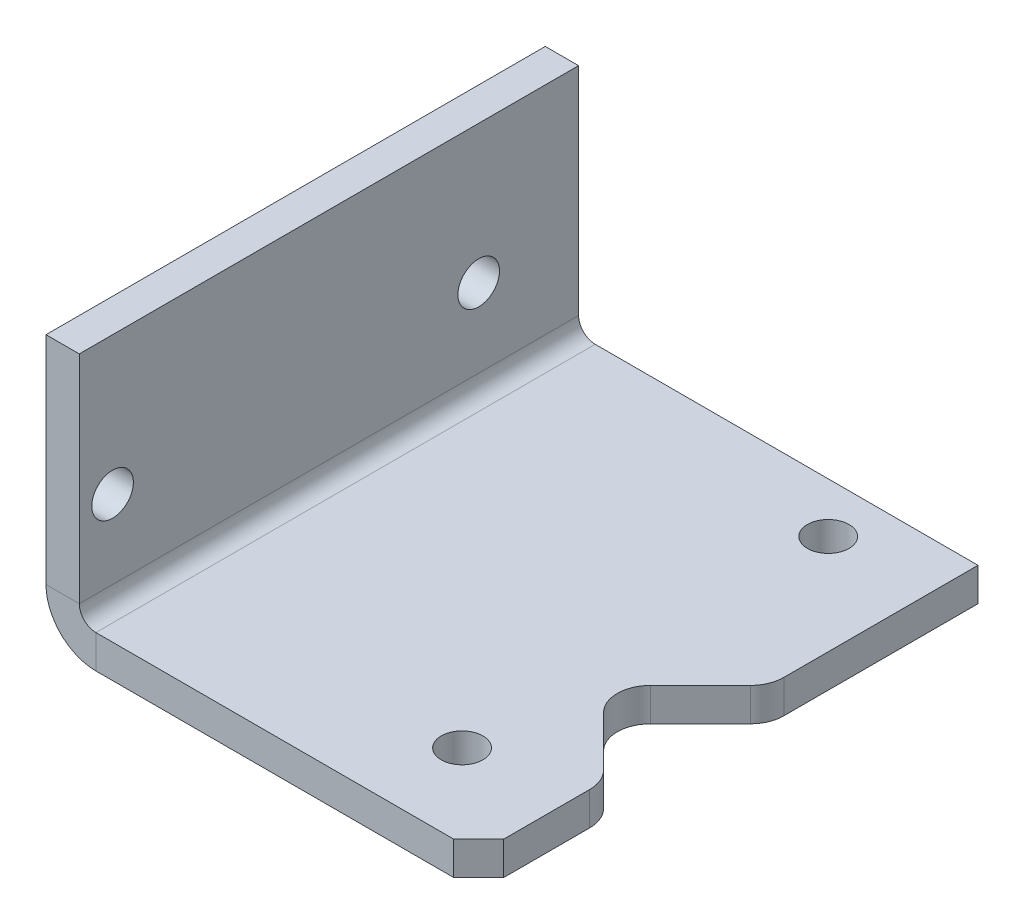
from build123d import *

# Parameters (mm, degrees)
ESBO_O1_W                      = 30
ESBO_O1_H                      = 14
FLANGE_BASE1_DEPTH             = 2
ARESTA_FLANGE1_STRIP_W         = 10
ARESTA_FLANGE1_STRIP_H         = 2
ARESTA_FLANGE1_STRIP_CUT_DEPTH = 30
ARESTA_FLANGE1_DEPTH           = 30
ESBO_O10_R                     = 1.25
CORTE_EXTRUS_O1_DEPTH          = 2
ESBO_O11_R                     = 1.25
CORTE_EXTRUS_O2_DEPTH          = 2
CHANFRO1_SIZE                  = 1.5
CORTE_EXTRUS_O3_DEPTH          = 2
FILETE1_R                      = 2


# Sheet-metal steps are written as plain solids
with BuildPart() as part:
    # Esboço1 → Flange-base1 (new body)
    with BuildSketch(Plane(origin=(0, 0, 0), x_dir=(0, 0, -1), z_dir=(1, 0, 0))):
        Rectangle(ESBO_O1_W, ESBO_O1_H)
    extrude(amount=-FLANGE_BASE1_DEPTH)

    # Aresta-Flange1 strip (across the edge) → Aresta-Flange1 strip cut (cut)
    with BuildSketch(Plane(origin=(0, -7, 15), x_dir=(0, 1, 0), z_dir=(0, 0, -1))):
        with Locations((-4, -1)):
            Rectangle(ARESTA_FLANGE1_STRIP_W, ARESTA_FLANGE1_STRIP_H)
    extrude(amount=ARESTA_FLANGE1_STRIP_CUT_DEPTH, mode=Mode.SUBTRACT)

    # Aresta-Flange1 section (across the edge) → Aresta-Flange1 (add)
    with BuildSketch(Plane(origin=(0, -7, 15), x_dir=(0, 1, 0), z_dir=(0, 0, -1))):
        with BuildLine():
            Line((-2, 1), (-2, 24))
            Line((-2, 24), (0, 24))
            Line((0, 24), (0, 1))
            ThreePointArc((0, 1), (0.292893219, 0.292893219), (1, 0))
            Line((1, 0), (1, -2))
            ThreePointArc((1, -2), (-1.121320344, -1.121320344), (-2, 1))
        make_face()
    extrude(amount=ARESTA_FLANGE1_DEPTH)

    # Esboço10 → Corte-extrusão1 (cut)
    with BuildSketch(Plane(origin=(0, 0, 0), x_dir=(0, 0, -1), z_dir=(1, 0, 0))):
        with Locations((-13, -1.3)):
            Circle(ESBO_O10_R)
        with Locations((9, -1.3)):
            Circle(ESBO_O10_R)
    extrude(amount=-CORTE_EXTRUS_O1_DEPTH, mode=Mode.SUBTRACT)

    # Esboço11 → Corte-extrusão2 (cut)
    with BuildSketch(Plane(origin=(0, -7, 0), x_dir=(1, 0, 0), z_dir=(0, 1, 0))):
        with Locations(Location((18, -10, 0), (0, 0, 180))):
            Circle(ESBO_O11_R)
        with Locations(Location((18, 12, 0), (0, 0, 180))):
            Circle(ESBO_O11_R)
    extrude(amount=-CORTE_EXTRUS_O2_DEPTH, mode=Mode.SUBTRACT)

    # Chanfro1
    chanfro1_edges = [part.edges().sort_by_distance(p)[0] for p in [
        (24, -8, 15),
    ]]
    chamfer(chanfro1_edges, length=CHANFRO1_SIZE)

    # Esboço12 → Corte-extrusão3 (cut)
    with BuildSketch(Plane(origin=(0, -7, 0), x_dir=(1, 0, 0), z_dir=(0, 1, 0))):
        with BuildLine():
            Line((19.828427125, -2.5), (24, -2.5))
            Line((24, -2.5), (24, 2.5))
            Line((24, 2.5), (20.414213562, -1.085786438))
            ThreePointArc((20.414213562, -1.085786438), (19.98066806, -1.734633135), (19.828427125, -2.5))
        make_face()
        with BuildLine():
            Line((24, -7.5), (24, -2.5))
            Line((24, -2.5), (19.828427125, -2.5))
            ThreePointArc((19.828427125, -2.5), (19.98066806, -3.265366865), (20.414213562, -3.914213562))
            Line((20.414213562, -3.914213562), (24, -7.5))
        make_face()
    extrude(amount=-CORTE_EXTRUS_O3_DEPTH, mode=Mode.SUBTRACT)

    # Filete1
    filete1_edges = [part.edges().sort_by_distance(p)[0] for p in [
        (24, -8, -2.5),
        (24, -8, 7.5),
    ]]
    fillet(filete1_edges, radius=FILETE1_R)


solid = part.part
